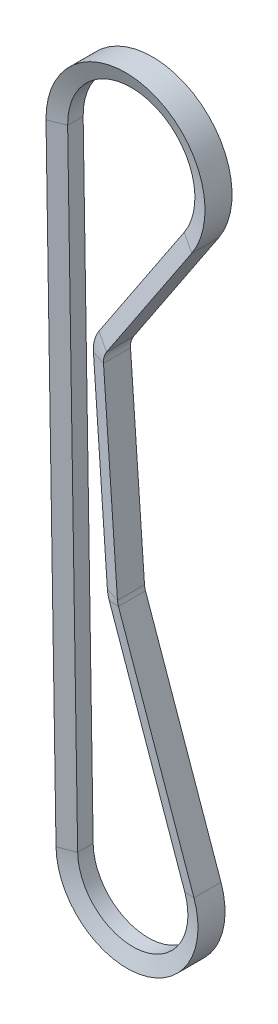
from build123d import *


with BuildPart() as part:
    # Sweep1: sweep along a path in Sketch2
    with BuildLine(Plane.XY) as sweep1_path:
        Line((-24.996786703, -0.400817338), (-28.523651322, 219.550452778))
        ThreePointArc((-28.523651322, 219.550452778), (7.355683132, 246.86680875), (22.788559228, 204.495399995))
        Line((22.788559228, 204.495399995), (-7.230529512, 159.350870312))
        ThreePointArc((-7.230529512, 159.350870312), (-8.082204815, 157.456723683), (-8.277175627, 155.389085259))
        Line((-8.277175627, 155.389085259), (-3.36387507, 85.561730464))
        ThreePointArc((-3.36387507, 85.561730464), (-3.247483233, 84.719167679), (-3.019530104, 83.899718792))
        Line((-3.019530104, 83.899718792), (23.582652155, 8.298103237))
        ThreePointArc((23.582652155, 8.298103237), (4.406557491, -24.608580842), (-24.996786703, -0.400817338))
    # Sketch3 → Sweep1 (sweep)
    with BuildSketch(Plane(origin=(23.582652155, 8.298103237, 0), x_dir=(-0.9433060862013718, -0.3319241294866199, 0), z_dir=(0.3319241294866199, -0.9433060862013718, 0))):
        Polygon((0, -4.7625), (0, 4.7625), (5.588, 2.728634331), (5.588, -2.728634331), align=None)
    sweep(path=sweep1_path.line)


solid = part.part
